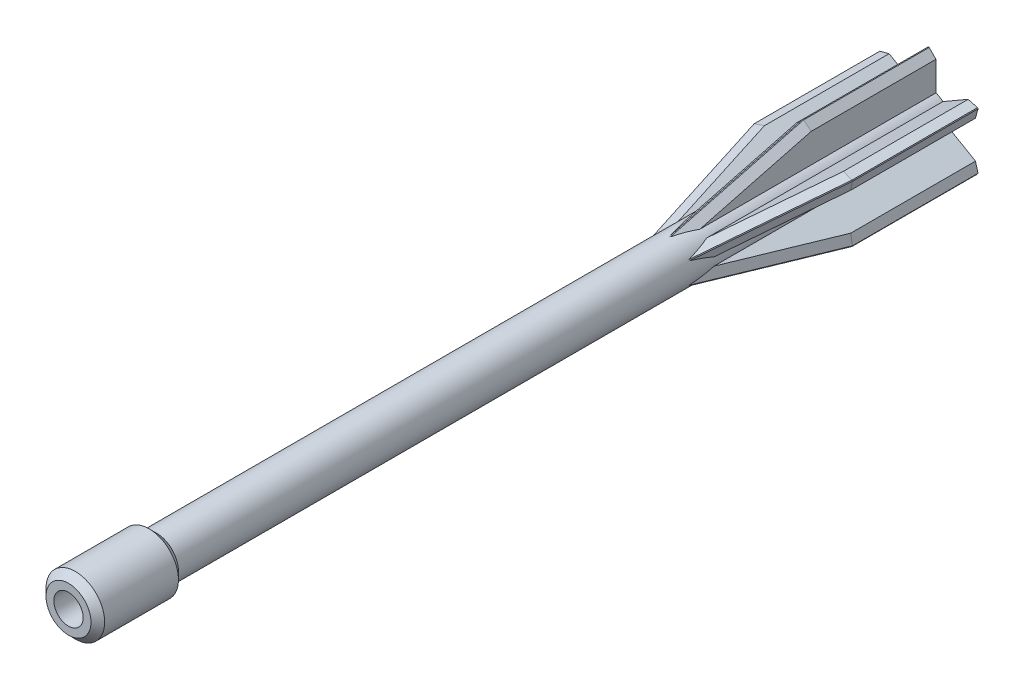
from build123d import *

# Parameters (mm, degrees)
SKETCH_1_R                           = 2.25
EXTRUDE_1_DEPTH                      = 80
EXTRUDE_3_DEPTH                      = 0.75
CHAMFER_4_SIZE                       = 0.7
PATTERN_CIRCULAR_1_COUNT             = 6
CHAMFER_4_OF_PATTERN_CIRCULAR_1_SIZE = 0.7
SKETCH_7_R                           = 3
EXTRUDE_4_DEPTH                      = 8
CHAMFER_6_SIZE                       = 1
CHAMFER_7_SIZE                       = 0.7
SKETCH_8_R                           = 1.5
CUT_EXTRUDE_3_DEPTH                  = 75
SKETCH_9_R                           = 2
CUT_EXTRUDE_4_DEPTH                  = 1
CHAMFER_8_SIZE                       = 1


# Some blends are built 0.0001 mm under size
with BuildPart() as part:
    # 스케치1 → 보스-돌출1 (new body)
    with BuildSketch(Plane.XY):
        Circle(SKETCH_1_R)
    extrude(amount=EXTRUDE_1_DEPTH)

    # 스케치5 → 보스-돌출3 (add, symmetric)
    with BuildSketch(Plane(origin=(0, 0, 0), x_dir=(0, 0, -1), z_dir=(1, 0, 0))):
        Polygon((0, 1.323110618), (0, 5.8), (-12.84952222, 5.8), (-30, 1.323110618), align=None)
    extrude_3 = extrude(amount=EXTRUDE_3_DEPTH, both=True)

    # 모따기4
    chamfer_4_edges = [part.edges().sort_by_distance(p)[0] for p in [
        (-0.75, 3.960660172, 19.895833657),
        (-0.75, 5.8, 6.42476111),
        (0.75, 5.8, 6.42476111),
        (0.75, 3.960660172, 19.895833657),
    ]]
    chamfer(chamfer_4_edges, length=CHAMFER_4_SIZE)

    # 원형 패턴1: 보스-돌출3 ×6 about axis
    pattern_circular_1_axis = Axis((0, 0, 0), (0, 0, 1))
    for i in range(1, PATTERN_CIRCULAR_1_COUNT):
        add(extrude_3.rotate(pattern_circular_1_axis, i * 360 / PATTERN_CIRCULAR_1_COUNT))

    # 모따기4 of 원형 패턴1
    chamfer_4_of_pattern_circular_1_edges = [part.edges().sort_by_distance(p)[0] for p in [
        (-3.805032325, 1.330811033, 19.895833657),
        (-5.397947342, 2.250480947, 6.42476111),
        (-4.647947342, 3.549519053, 6.42476111),
        (-3.055032325, 2.629849139, 19.895833657),
        (-3.055032325, -2.629849139, 19.895833657),
        (-4.647947342, -3.549519053, 6.42476111),
        (-5.397947342, -2.250480947, 6.42476111),
        (-3.805032325, -1.330811033, 19.895833657),
        (0.75, -3.960660172, 19.895833657),
        (0.75, -5.8, 6.42476111),
        (-0.75, -5.8, 6.42476111),
        (-0.75, -3.960660172, 19.895833657),
        (3.805032325, -1.330811033, 19.895833657),
        (5.397947342, -2.250480947, 6.42476111),
        (4.647947342, -3.549519053, 6.42476111),
        (3.055032325, -2.629849139, 19.895833657),
        (3.055032325, 2.629849139, 19.895833657),
        (4.647947342, 3.549519053, 6.42476111),
        (5.397947342, 2.250480947, 6.42476111),
        (3.805032325, 1.330811033, 19.895833657),
    ]]
    chamfer(chamfer_4_of_pattern_circular_1_edges, length=CHAMFER_4_OF_PATTERN_CIRCULAR_1_SIZE)

    # 스케치7 → 보스-돌출4 (add)
    with BuildSketch(Plane.XY.offset(80)):
        Circle(SKETCH_7_R)
    extrude(amount=EXTRUDE_4_DEPTH)

    # 모따기6
    # the kernel refuses this chamfer: 1 mm, written as the material it adds along each edge
    with BuildSketch(Plane(origin=(0, 0, 80), x_dir=(1, 0, 0), z_dir=(0, -1, 0))) as chamfer_6_piece_1_section:
        Polygon((2.25 + CHAMFER_6_SIZE, 0), (2.25, -CHAMFER_6_SIZE), (2.25, 0), align=None)
    chamfer_6_piece_1 = revolve(axis=Axis((0, 0, 80), (0, 0, 1)), mode=Mode.PRIVATE)
    chamfer_6_piece_1 = chamfer_6_piece_1 & Plane(origin=(0, 0, 79.375065252), x_dir=(1, 0, 0), z_dir=(0, 0, -1)) * Cylinder(3, 13, mode=Mode.PRIVATE)
    add(chamfer_6_piece_1)

    # 모따기7
    chamfer_7_edges = [part.edges().sort_by_distance(p)[0] for p in [
        (-3, 0, 88),
    ]]
    chamfer(chamfer_7_edges, length=CHAMFER_7_SIZE)

    # 스케치8 → 컷-돌출3 (cut)
    with BuildSketch(Plane.XY.offset(88)):
        Circle(SKETCH_8_R)
    extrude(amount=-CUT_EXTRUDE_3_DEPTH, mode=Mode.SUBTRACT)

    # 스케치9 → 컷-돌출4 (cut)
    with BuildSketch(Plane.XY):
        Circle(SKETCH_9_R)
    extrude(amount=CUT_EXTRUDE_4_DEPTH, mode=Mode.SUBTRACT)

    # 모따기8
    chamfer_8_edges = [part.edges().sort_by_distance(p)[0] for p in [
        (-2, 0, 1),
    ]]
    chamfer(chamfer_8_edges, length=CHAMFER_8_SIZE - 0.0001)  # a hair under: the kernel refuses the full size


solid = part.part
